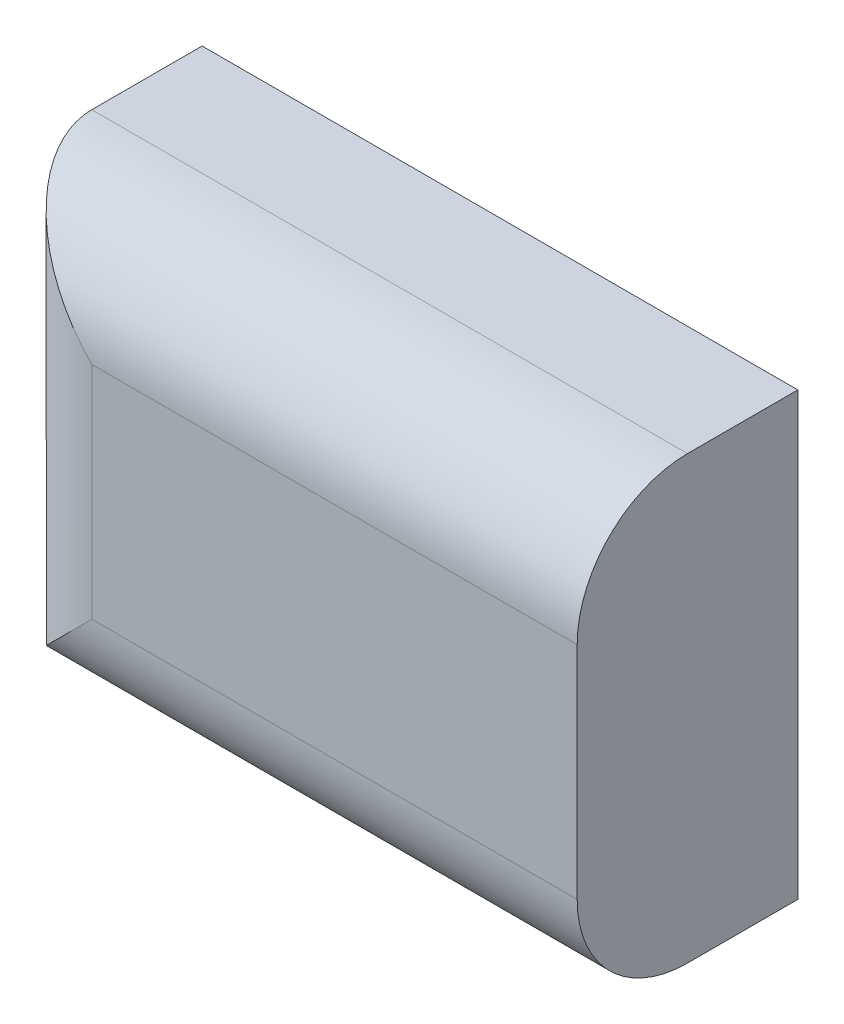
from build123d import *

# Parameters (mm, degrees)
SKETCH1_W           = 63.5
SKETCH1_H           = 127
BOSS_EXTRUDE1_DEPTH = 171.45
FILLET1_R           = 31.75


with BuildPart() as part:
    # Sketch1 → Boss-Extrude1 (new body)
    with BuildSketch(Plane(origin=(0, 0, 0), x_dir=(0, 0, -1), z_dir=(1, 0, 0))):
        with Locations((-5.766791516, 21.358919545)):
            Rectangle(SKETCH1_W, SKETCH1_H)
    extrude(amount=BOSS_EXTRUDE1_DEPTH)

    # Fillet1
    fillet1_edges = [part.edges().sort_by_distance(p)[0] for p in [
        (0, 21.358919545, 37.516791516),
        (85.725, -42.141080455, 37.516791516),
        (85.725, 84.858919545, 37.516791516),
    ]]
    fillet(fillet1_edges, radius=FILLET1_R)


solid = part.part
